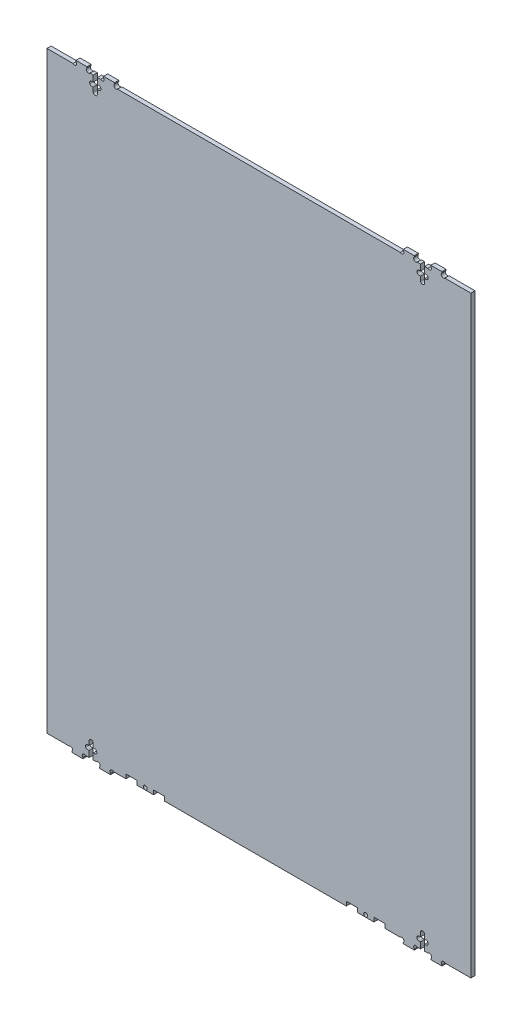
from build123d import *

# Parameters (mm, degrees)
SKETCH_2_W                      = 620.3
SKETCH_2_H                      = 871.6
EXTRUDE_1_DEPTH                 = 6
CUT_EXTRUDE_5_DEPTH             = 1219.886594397
CUT_EXTRUDE_5_DEPTH_BACK        = 1219.886594397
SKETCH_5_R                      = 2.75
SKETCH_5_W                      = 42.1
SKETCH_5_H                      = 6
SKETCH_5_W_2                    = 418.3
CUT_EXTRUDE_6_01_DEPTH          = 1219.886594397
CUT_EXTRUDE_6_01_DEPTH_BACK     = 1219.886594397
SKETCH_6_01_W                   = 6
SKETCH_6_01_H                   = 21.2
CUT_EXTRUDE_6_01_2_DEPTH        = 1219.886594397
CUT_EXTRUDE_6_01_2_DEPTH_BACK   = 1219.886594397
SKETCH_6_01_2_W                 = 10.3
SKETCH_6_01_2_H                 = 6.2
CUT_EXTRUDE_6_01_1_DEPTH        = 1219.886594397
CUT_EXTRUDE_6_01_1_DEPTH_BACK   = 1219.886594397
SKETCH_6_01_1_R                 = 3.05
CUT_EXTRUDE_6_01_1_2_DEPTH      = 1219.886594397
CUT_EXTRUDE_6_01_1_2_DEPTH_BACK = 1219.886594397
SKETCH_6_01_1_2_R               = 3.05
CUT_EXTRUDE_6_01_3_DEPTH        = 1219.886594397
CUT_EXTRUDE_6_01_3_DEPTH_BACK   = 1219.886594397
SKETCH_6_01_3_R                 = 3
CUT_EXTRUDE_6_02_DEPTH          = 1219.886594397
CUT_EXTRUDE_6_02_DEPTH_BACK     = 1219.886594397
SKETCH_6_02_W                   = 6
SKETCH_6_02_H                   = 21.2
CUT_EXTRUDE_6_02_2_DEPTH        = 1219.886594397
CUT_EXTRUDE_6_02_2_DEPTH_BACK   = 1219.886594397
SKETCH_6_02_2_W                 = 10.3
SKETCH_6_02_2_H                 = 6.2
CUT_EXTRUDE_6_02_1_DEPTH        = 1219.886594397
CUT_EXTRUDE_6_02_1_DEPTH_BACK   = 1219.886594397
SKETCH_6_02_1_R                 = 3.05
CUT_EXTRUDE_6_02_1_2_DEPTH      = 1219.886594397
CUT_EXTRUDE_6_02_1_2_DEPTH_BACK = 1219.886594397
SKETCH_6_02_1_2_R               = 3.05
CUT_EXTRUDE_6_02_3_DEPTH        = 1219.886594397
CUT_EXTRUDE_6_02_3_DEPTH_BACK   = 1219.886594397
SKETCH_6_02_3_R                 = 3
CUT_EXTRUDE_6_03_DEPTH          = 1219.886594397
CUT_EXTRUDE_6_03_DEPTH_BACK     = 1219.886594397
SKETCH_6_03_W                   = 6
SKETCH_6_03_H                   = 21.2
CUT_EXTRUDE_6_03_2_DEPTH        = 1219.886594397
CUT_EXTRUDE_6_03_2_DEPTH_BACK   = 1219.886594397
SKETCH_6_03_2_W                 = 10.3
SKETCH_6_03_2_H                 = 6.2
CUT_EXTRUDE_6_03_1_DEPTH        = 1219.886594397
CUT_EXTRUDE_6_03_1_DEPTH_BACK   = 1219.886594397
SKETCH_6_03_1_R                 = 3.05
CUT_EXTRUDE_6_03_1_2_DEPTH      = 1219.886594397
CUT_EXTRUDE_6_03_1_2_DEPTH_BACK = 1219.886594397
SKETCH_6_03_1_2_R               = 3.05
CUT_EXTRUDE_6_03_3_DEPTH        = 1219.886594397
CUT_EXTRUDE_6_03_3_DEPTH_BACK   = 1219.886594397
SKETCH_6_03_3_R                 = 3
CUT_EXTRUDE_6_04_DEPTH          = 1219.886594397
CUT_EXTRUDE_6_04_DEPTH_BACK     = 1219.886594397
SKETCH_6_04_W                   = 6
SKETCH_6_04_H                   = 21.2
CUT_EXTRUDE_6_04_2_DEPTH        = 1219.886594397
CUT_EXTRUDE_6_04_2_DEPTH_BACK   = 1219.886594397
SKETCH_6_04_2_W                 = 10.3
SKETCH_6_04_2_H                 = 6.2
CUT_EXTRUDE_6_04_1_DEPTH        = 1219.886594397
CUT_EXTRUDE_6_04_1_DEPTH_BACK   = 1219.886594397
SKETCH_6_04_1_R                 = 3.05
CUT_EXTRUDE_6_04_1_2_DEPTH      = 1219.886594397
CUT_EXTRUDE_6_04_1_2_DEPTH_BACK = 1219.886594397
SKETCH_6_04_1_2_R               = 3.05
CUT_EXTRUDE_6_04_3_DEPTH        = 1219.886594397
CUT_EXTRUDE_6_04_3_DEPTH_BACK   = 1219.886594397
SKETCH_6_04_3_R                 = 3
CUT_EXTRUDE_01_DEPTH            = 1219.886594397
CUT_EXTRUDE_01_DEPTH_BACK       = 1219.886594397
SKETCH_01_R                     = 3.05
CUT_EXTRUDE_02_DEPTH            = 1219.886594397
CUT_EXTRUDE_02_DEPTH_BACK       = 1219.886594397
SKETCH_02_R                     = 3.05
CUT_EXTRUDE_03_DEPTH            = 1219.886594397
CUT_EXTRUDE_03_DEPTH_BACK       = 1219.886594397
SKETCH_03_R                     = 3.05
CUT_EXTRUDE_04_DEPTH            = 1219.886594397
CUT_EXTRUDE_04_DEPTH_BACK       = 1219.886594397
SKETCH_04_R                     = 3.05


with BuildPart() as part:
    # Эскиз2 → Бобышка-Вытянуть1 (new body)
    with BuildSketch(Plane.XY):
        with Locations((828.15, 0)):
            Rectangle(SKETCH_2_W, SKETCH_2_H)
    extrude(amount=-EXTRUDE_1_DEPTH)

    # Стыки_эскиз_пазов_и_стяжек_М5 → Стыки_шип_паз_стяжки_М5 (cut, two sides: drawn at the far end of the back side and taken through both)
    with BuildSketch(Plane.XY.offset(-CUT_EXTRUDE_5_DEPTH_BACK)):
        with Locations((666.5, -426.8)):
            Circle(SKETCH_5_R)
        with Locations((985.8, -426.8)):
            Circle(SKETCH_5_R)
        with Locations((1117.35, 432.8)):
            Rectangle(SKETCH_5_W, SKETCH_5_H)
        Polygon((678.425, -423.725), (678.425, -429.8), (654.575, -429.8), (654.575, -423.725), (638.425, -423.725), (638.425, -429.8), (616, -429.8), (616, -435.8), (1040.3, -435.8), (1040.3, -429.8), (1013.875, -429.8), (1013.875, -423.725), (997.725, -423.725), (997.725, -429.8), (973.875, -429.8), (973.875, -423.725), (957.725, -423.725), (957.725, -429.8), (694.575, -429.8), (694.575, -423.725), align=None)
        Polygon((590.75, -419.95), (592.15, -419.95), (592.15, -415.65), (590.75, -415.65), (590.75, -408.8), (585.25, -408.8), (585.25, -415.65), (583.85, -415.65), (583.85, -419.95), (585.25, -419.95), (585.25, -429.8), (576, -429.8), (576, -435.8), (585.25, -435.8), (585.25, -435.9), (590.75, -435.9), (590.75, -435.8), (600, -435.8), (600, -429.8), (590.75, -429.8), align=None)
        Polygon((518, 435.8), (518, -429.8), (517.9, -429.8), (517.9, -435.8), (560, -435.8), (560, -429.8), (524, -429.8), (524, 429.8), (566, 429.8), (566, 435.8), align=None)
        with Locations((831.15, 432.8)):
            Rectangle(SKETCH_5_W_2, SKETCH_5_H)
        Polygon((1065.55, -435.8), (1065.55, -435.9), (1071.05, -435.9), (1071.05, -435.8), (1080.3, -435.8), (1080.3, -429.8), (1071.05, -429.8), (1071.05, -419.95), (1072.45, -419.95), (1072.45, -415.65), (1071.05, -415.65), (1071.05, -408.8), (1065.55, -408.8), (1065.55, -415.65), (1064.15, -415.65), (1064.15, -419.95), (1065.55, -419.95), (1065.55, -429.8), (1056.3, -429.8), (1056.3, -435.8), align=None)
        Polygon((1071.05, 415.65), (1072.45, 415.65), (1072.45, 419.95), (1071.05, 419.95), (1071.05, 429.8), (1080.3, 429.8), (1080.3, 435.8), (1071.05, 435.8), (1071.05, 435.9), (1065.55, 435.9), (1065.55, 435.8), (1056.3, 435.8), (1056.3, 429.8), (1065.55, 429.8), (1065.55, 419.95), (1064.15, 419.95), (1064.15, 415.65), (1065.55, 415.65), (1065.55, 408.8), (1071.05, 408.8), align=None)
        Polygon((596.75, 435.8), (596.75, 435.9), (591.25, 435.9), (591.25, 435.8), (582, 435.8), (582, 429.8), (591.25, 429.8), (591.25, 419.95), (589.85, 419.95), (589.85, 415.65), (591.25, 415.65), (591.25, 408.8), (596.75, 408.8), (596.75, 415.65), (598.15, 415.65), (598.15, 419.95), (596.75, 419.95), (596.75, 429.8), (606, 429.8), (606, 435.8), align=None)
        with Locations((1117.35, -432.8)):
            Rectangle(SKETCH_5_W, SKETCH_5_H)
    extrude(amount=CUT_EXTRUDE_5_DEPTH + CUT_EXTRUDE_5_DEPTH_BACK, mode=Mode.SUBTRACT)

    # Sketch 6_01 → Cut-Extrude 6_01 (cut, two sides: drawn at the far end of the back side and taken through both)
    with BuildSketch(Plane.XY.offset(-CUT_EXTRUDE_6_01_DEPTH_BACK)):
        with Locations((1068.3, -419.3)):
            Rectangle(SKETCH_6_01_W, SKETCH_6_01_H)
    extrude(amount=CUT_EXTRUDE_6_01_DEPTH + CUT_EXTRUDE_6_01_DEPTH_BACK, mode=Mode.SUBTRACT)

    # Sketch 6_01 2 → Cut-Extrude 6_01 2 (cut, two sides: drawn at the far end of the back side and taken through both)
    with BuildSketch(Plane.XY.offset(-CUT_EXTRUDE_6_01_2_DEPTH_BACK)):
        with Locations((1068.3, -417.8)):
            Rectangle(SKETCH_6_01_2_W, SKETCH_6_01_2_H)
    extrude(amount=CUT_EXTRUDE_6_01_2_DEPTH + CUT_EXTRUDE_6_01_2_DEPTH_BACK, mode=Mode.SUBTRACT)

    # Sketch 6_01_____1 → Cut-Extrude 6_01_____1 (cut, two sides: drawn at the far end of the back side and taken through both)
    with BuildSketch(Plane.XY.offset(-CUT_EXTRUDE_6_01_1_DEPTH_BACK)):
        with Locations((1073.45, -417.75)):
            Circle(SKETCH_6_01_1_R)
        with Locations((1063.15, -417.75)):
            Circle(SKETCH_6_01_1_R)
    extrude(amount=CUT_EXTRUDE_6_01_1_DEPTH + CUT_EXTRUDE_6_01_1_DEPTH_BACK, mode=Mode.SUBTRACT)

    # Sketch 6_01_____-1 2 → Cut-Extrude 6_01_____-1 2 (cut, two sides: drawn at the far end of the back side and taken through both)
    with BuildSketch(Plane.XY.offset(-CUT_EXTRUDE_6_01_1_2_DEPTH_BACK)):
        with Locations((1073.45, -417.85)):
            Circle(SKETCH_6_01_1_2_R)
        with Locations((1063.15, -417.85)):
            Circle(SKETCH_6_01_1_2_R)
    extrude(amount=CUT_EXTRUDE_6_01_1_2_DEPTH + CUT_EXTRUDE_6_01_1_2_DEPTH_BACK, mode=Mode.SUBTRACT)

    # Sketch 6_01 3 → Cut-Extrude 6_01 3 (cut, two sides: drawn at the far end of the back side and taken through both)
    with BuildSketch(Plane.XY.offset(-CUT_EXTRUDE_6_01_3_DEPTH_BACK)):
        with Locations((1068.3, -408.7)):
            Circle(SKETCH_6_01_3_R)
    extrude(amount=CUT_EXTRUDE_6_01_3_DEPTH + CUT_EXTRUDE_6_01_3_DEPTH_BACK, mode=Mode.SUBTRACT)

    # Sketch 6_02 → Cut-Extrude 6_02 (cut, two sides: drawn at the far end of the back side and taken through both)
    with BuildSketch(Plane.XY.offset(-CUT_EXTRUDE_6_02_DEPTH_BACK)):
        with Locations((1068.3, 419.3)):
            Rectangle(SKETCH_6_02_W, SKETCH_6_02_H)
    extrude(amount=CUT_EXTRUDE_6_02_DEPTH + CUT_EXTRUDE_6_02_DEPTH_BACK, mode=Mode.SUBTRACT)

    # Sketch 6_02 2 → Cut-Extrude 6_02 2 (cut, two sides: drawn at the far end of the back side and taken through both)
    with BuildSketch(Plane.XY.offset(-CUT_EXTRUDE_6_02_2_DEPTH_BACK)):
        with Locations((1068.3, 417.8)):
            Rectangle(SKETCH_6_02_2_W, SKETCH_6_02_2_H)
    extrude(amount=CUT_EXTRUDE_6_02_2_DEPTH + CUT_EXTRUDE_6_02_2_DEPTH_BACK, mode=Mode.SUBTRACT)

    # Sketch 6_02_____1 → Cut-Extrude 6_02_____1 (cut, two sides: drawn at the far end of the back side and taken through both)
    with BuildSketch(Plane.XY.offset(-CUT_EXTRUDE_6_02_1_DEPTH_BACK)):
        with Locations((1073.45, 417.85)):
            Circle(SKETCH_6_02_1_R)
        with Locations((1063.15, 417.85)):
            Circle(SKETCH_6_02_1_R)
    extrude(amount=CUT_EXTRUDE_6_02_1_DEPTH + CUT_EXTRUDE_6_02_1_DEPTH_BACK, mode=Mode.SUBTRACT)

    # Sketch 6_02_____-1 2 → Cut-Extrude 6_02_____-1 2 (cut, two sides: drawn at the far end of the back side and taken through both)
    with BuildSketch(Plane.XY.offset(-CUT_EXTRUDE_6_02_1_2_DEPTH_BACK)):
        with Locations((1073.45, 417.75)):
            Circle(SKETCH_6_02_1_2_R)
        with Locations((1063.15, 417.75)):
            Circle(SKETCH_6_02_1_2_R)
    extrude(amount=CUT_EXTRUDE_6_02_1_2_DEPTH + CUT_EXTRUDE_6_02_1_2_DEPTH_BACK, mode=Mode.SUBTRACT)

    # Sketch 6_02 3 → Cut-Extrude 6_02 3 (cut, two sides: drawn at the far end of the back side and taken through both)
    with BuildSketch(Plane.XY.offset(-CUT_EXTRUDE_6_02_3_DEPTH_BACK)):
        with Locations((1068.3, 408.7)):
            Circle(SKETCH_6_02_3_R)
    extrude(amount=CUT_EXTRUDE_6_02_3_DEPTH + CUT_EXTRUDE_6_02_3_DEPTH_BACK, mode=Mode.SUBTRACT)

    # Sketch 6_03 → Cut-Extrude 6_03 (cut, two sides: drawn at the far end of the back side and taken through both)
    with BuildSketch(Plane.XY.offset(-CUT_EXTRUDE_6_03_DEPTH_BACK)):
        with Locations((594, 419.3)):
            Rectangle(SKETCH_6_03_W, SKETCH_6_03_H)
    extrude(amount=CUT_EXTRUDE_6_03_DEPTH + CUT_EXTRUDE_6_03_DEPTH_BACK, mode=Mode.SUBTRACT)

    # Sketch 6_03 2 → Cut-Extrude 6_03 2 (cut, two sides: drawn at the far end of the back side and taken through both)
    with BuildSketch(Plane.XY.offset(-CUT_EXTRUDE_6_03_2_DEPTH_BACK)):
        with Locations((594, 417.8)):
            Rectangle(SKETCH_6_03_2_W, SKETCH_6_03_2_H)
    extrude(amount=CUT_EXTRUDE_6_03_2_DEPTH + CUT_EXTRUDE_6_03_2_DEPTH_BACK, mode=Mode.SUBTRACT)

    # Sketch 6_03_____1 → Cut-Extrude 6_03_____1 (cut, two sides: drawn at the far end of the back side and taken through both)
    with BuildSketch(Plane.XY.offset(-CUT_EXTRUDE_6_03_1_DEPTH_BACK)):
        with Locations((599.15, 417.85)):
            Circle(SKETCH_6_03_1_R)
        with Locations((588.85, 417.85)):
            Circle(SKETCH_6_03_1_R)
    extrude(amount=CUT_EXTRUDE_6_03_1_DEPTH + CUT_EXTRUDE_6_03_1_DEPTH_BACK, mode=Mode.SUBTRACT)

    # Sketch 6_03_____-1 2 → Cut-Extrude 6_03_____-1 2 (cut, two sides: drawn at the far end of the back side and taken through both)
    with BuildSketch(Plane.XY.offset(-CUT_EXTRUDE_6_03_1_2_DEPTH_BACK)):
        with Locations((599.15, 417.75)):
            Circle(SKETCH_6_03_1_2_R)
        with Locations((588.85, 417.75)):
            Circle(SKETCH_6_03_1_2_R)
    extrude(amount=CUT_EXTRUDE_6_03_1_2_DEPTH + CUT_EXTRUDE_6_03_1_2_DEPTH_BACK, mode=Mode.SUBTRACT)

    # Sketch 6_03 3 → Cut-Extrude 6_03 3 (cut, two sides: drawn at the far end of the back side and taken through both)
    with BuildSketch(Plane.XY.offset(-CUT_EXTRUDE_6_03_3_DEPTH_BACK)):
        with Locations((594, 408.7)):
            Circle(SKETCH_6_03_3_R)
    extrude(amount=CUT_EXTRUDE_6_03_3_DEPTH + CUT_EXTRUDE_6_03_3_DEPTH_BACK, mode=Mode.SUBTRACT)

    # Sketch 6_04 → Cut-Extrude 6_04 (cut, two sides: drawn at the far end of the back side and taken through both)
    with BuildSketch(Plane.XY.offset(-CUT_EXTRUDE_6_04_DEPTH_BACK)):
        with Locations((588, -419.3)):
            Rectangle(SKETCH_6_04_W, SKETCH_6_04_H)
    extrude(amount=CUT_EXTRUDE_6_04_DEPTH + CUT_EXTRUDE_6_04_DEPTH_BACK, mode=Mode.SUBTRACT)

    # Sketch 6_04 2 → Cut-Extrude 6_04 2 (cut, two sides: drawn at the far end of the back side and taken through both)
    with BuildSketch(Plane.XY.offset(-CUT_EXTRUDE_6_04_2_DEPTH_BACK)):
        with Locations((588, -417.8)):
            Rectangle(SKETCH_6_04_2_W, SKETCH_6_04_2_H)
    extrude(amount=CUT_EXTRUDE_6_04_2_DEPTH + CUT_EXTRUDE_6_04_2_DEPTH_BACK, mode=Mode.SUBTRACT)

    # Sketch 6_04_____1 → Cut-Extrude 6_04_____1 (cut, two sides: drawn at the far end of the back side and taken through both)
    with BuildSketch(Plane.XY.offset(-CUT_EXTRUDE_6_04_1_DEPTH_BACK)):
        with Locations((593.15, -417.75)):
            Circle(SKETCH_6_04_1_R)
        with Locations((582.85, -417.75)):
            Circle(SKETCH_6_04_1_R)
    extrude(amount=CUT_EXTRUDE_6_04_1_DEPTH + CUT_EXTRUDE_6_04_1_DEPTH_BACK, mode=Mode.SUBTRACT)

    # Sketch 6_04_____-1 2 → Cut-Extrude 6_04_____-1 2 (cut, two sides: drawn at the far end of the back side and taken through both)
    with BuildSketch(Plane.XY.offset(-CUT_EXTRUDE_6_04_1_2_DEPTH_BACK)):
        with Locations((593.15, -417.85)):
            Circle(SKETCH_6_04_1_2_R)
        with Locations((582.85, -417.85)):
            Circle(SKETCH_6_04_1_2_R)
    extrude(amount=CUT_EXTRUDE_6_04_1_2_DEPTH + CUT_EXTRUDE_6_04_1_2_DEPTH_BACK, mode=Mode.SUBTRACT)

    # Sketch 6_04 3 → Cut-Extrude 6_04 3 (cut, two sides: drawn at the far end of the back side and taken through both)
    with BuildSketch(Plane.XY.offset(-CUT_EXTRUDE_6_04_3_DEPTH_BACK)):
        with Locations((588, -408.7)):
            Circle(SKETCH_6_04_3_R)
    extrude(amount=CUT_EXTRUDE_6_04_3_DEPTH + CUT_EXTRUDE_6_04_3_DEPTH_BACK, mode=Mode.SUBTRACT)

    # ЧПУ_Шаблон_углов_01 → ЧПУ_Разгрузки_01 (cut, two sides: drawn at the far end of the back side and taken through both)
    with BuildSketch(Plane.XY.offset(-CUT_EXTRUDE_01_DEPTH_BACK)):
        with Locations((1058.421320344, -431.921320344)):
            Circle(SKETCH_01_R)
        with Locations((1098.421320344, -431.921320344)):
            Circle(SKETCH_01_R)
        with Locations((578.121320344, -431.921320344)):
            Circle(SKETCH_01_R)
        with Locations((618.121320344, -431.921320344)):
            Circle(SKETCH_01_R)
    extrude(amount=CUT_EXTRUDE_01_DEPTH + CUT_EXTRUDE_01_DEPTH_BACK, mode=Mode.SUBTRACT)

    # ЧПУ_Шаблон_углов_02 → ЧПУ_Разгрузки_02 (cut, two sides: drawn at the far end of the back side and taken through both)
    with BuildSketch(Plane.XY.offset(-CUT_EXTRUDE_02_DEPTH_BACK)):
        with Locations((1078.178679656, -431.921320344)):
            Circle(SKETCH_02_R)
        with Locations((557.878679656, -431.921320344)):
            Circle(SKETCH_02_R)
        with Locations((597.878679656, -431.921320344)):
            Circle(SKETCH_02_R)
        with Locations((1038.178679656, -431.921320344)):
            Circle(SKETCH_02_R)
    extrude(amount=CUT_EXTRUDE_02_DEPTH + CUT_EXTRUDE_02_DEPTH_BACK, mode=Mode.SUBTRACT)

    # ЧПУ_Шаблон_углов_03 → ЧПУ_Разгрузки_03 (cut, two sides: drawn at the far end of the back side and taken through both)
    with BuildSketch(Plane.XY.offset(-CUT_EXTRUDE_03_DEPTH_BACK)):
        with Locations((1098.421320344, 431.921320344)):
            Circle(SKETCH_03_R)
        with Locations((1058.421320344, 431.921320344)):
            Circle(SKETCH_03_R)
        with Locations((624.121320344, 431.921320344)):
            Circle(SKETCH_03_R)
        with Locations((584.121320344, 431.921320344)):
            Circle(SKETCH_03_R)
    extrude(amount=CUT_EXTRUDE_03_DEPTH + CUT_EXTRUDE_03_DEPTH_BACK, mode=Mode.SUBTRACT)

    # ЧПУ_Шаблон_углов_04 → ЧПУ_Разгрузки_04 (cut, two sides: drawn at the far end of the back side and taken through both)
    with BuildSketch(Plane.XY.offset(-CUT_EXTRUDE_04_DEPTH_BACK)):
        with Locations((1078.178679656, 431.921320344)):
            Circle(SKETCH_04_R)
        with Locations((1038.178679656, 431.921320344)):
            Circle(SKETCH_04_R)
        with Locations((603.878679656, 431.921320344)):
            Circle(SKETCH_04_R)
        with Locations((563.878679656, 431.921320344)):
            Circle(SKETCH_04_R)
    extrude(amount=CUT_EXTRUDE_04_DEPTH + CUT_EXTRUDE_04_DEPTH_BACK, mode=Mode.SUBTRACT)


solid = part.part
